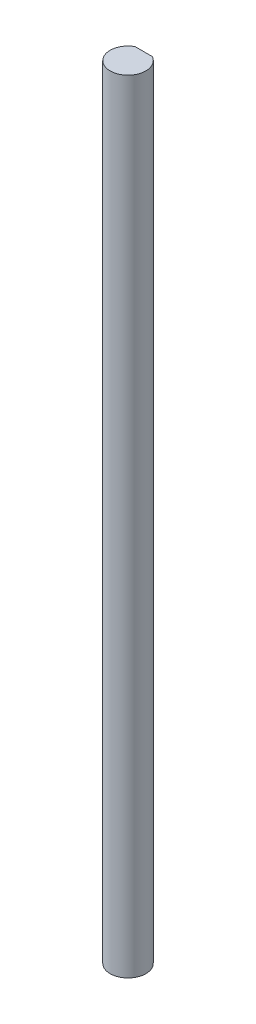
from build123d import *

# Parameters (mm, degrees)
BOSS_EXTRUDE1_DEPTH = 175


with BuildPart() as part:
    # Sketch1 → Boss-Extrude1 (new body)
    with BuildSketch(Plane(origin=(0, 0, 0), x_dir=(1, 0, 0), z_dir=(0, 1, 0))):
        with BuildLine():
            Line((-1.936491673, 3.5), (1.936491673, 3.5))
            ThreePointArc((1.936491673, 3.5), (0, -4), (-1.936491673, 3.5))
        make_face()
    extrude(amount=BOSS_EXTRUDE1_DEPTH)


solid = part.part
